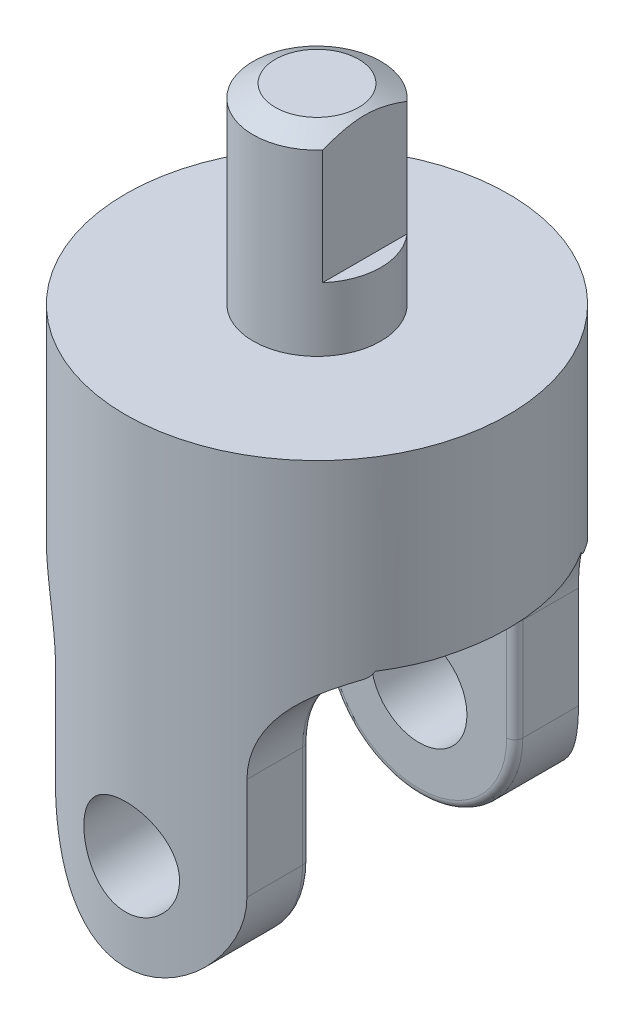
from build123d import *

# Parameters (mm, degrees)
SKETCH1_R               = 19.05
BASE_EXTRUDE_DEPTH      = 47.625
CUT_EXTRUDE1_DEPTH      = 55.716959208
CUT_EXTRUDE1_DEPTH_BACK = 55.716959208
CUT_EXTRUDE5_DEPTH      = 47.625
CUT_EXTRUDE5_DEPTH_BACK = 55.716959365
SKETCH8_W               = 20.32
SKETCH8_H               = 36.600526062
FILLET1_R               = 0.8001
CUT_EXTRUDE6_DEPTH      = 55.716959365
CUT_EXTRUDE6_DEPTH_BACK = 55.716959365
SKETCH11_R              = 4.7625
SKETCH12_R              = 6.35
BOSS_EXTRUDE1_DEPTH     = 19.05
CHAMFER3_SIZE           = 1.27
CHAMFER3_SIZE2          = 2.199704526
CUT_EXTRUDE7_START      = -12.7
CUT_EXTRUDE7_DEPTH      = 12.7


with BuildPart() as part:
    # Sketch1 → Base-Extrude (new body)
    with BuildSketch(Plane(origin=(0, 0, 0), x_dir=(-1, 0, 0), z_dir=(0, 1, 0))):
        with Locations(Location((0, 0, 0), (0, 0, 90))):
            Circle(SKETCH1_R)
    extrude(amount=BASE_EXTRUDE_DEPTH)

    # Sketch2 → Cut-Extrude1 (cut, two sides: drawn at the far end of the back side and taken through both)
    with BuildSketch(Plane.XY.offset(-CUT_EXTRUDE1_DEPTH_BACK)):
        with BuildLine():
            Line((9.525, 9.525), (9.525, 19.685))
            ThreePointArc((9.525, 19.685), (12.314807909, 26.420192091), (19.05, 29.21))
            Line((19.05, 29.21), (19.05, -1.366191125))
            Line((19.05, -1.366191125), (-19.05, -1.366191125))
            Line((-19.05, -1.366191125), (-19.05, 29.21))
            ThreePointArc((-19.05, 29.21), (-12.314807909, 26.420192091), (-9.525, 19.685))
            Line((-9.525, 19.685), (-9.525, 9.525))
            ThreePointArc((-9.525, 9.525), (0, 0), (9.525, 9.525))
        make_face()
    extrude(amount=CUT_EXTRUDE1_DEPTH + CUT_EXTRUDE1_DEPTH_BACK, mode=Mode.SUBTRACT)

    # Sketch8 → Cut-Extrude5 (cut, two sides: drawn at the far end of the back side and taken through both)
    with BuildSketch(Plane(origin=(0, 0, 0), x_dir=(0, 0, -1), z_dir=(1, 0, 0)).offset(-CUT_EXTRUDE5_DEPTH_BACK)):
        with Locations((0, 10.844975795)):
            Rectangle(SKETCH8_W, SKETCH8_H)
    extrude(amount=CUT_EXTRUDE5_DEPTH + CUT_EXTRUDE5_DEPTH_BACK, mode=Mode.SUBTRACT)

    # Fillet1
    # the kernel refuses this fillet: 0.8001 mm, written as the material it takes off along each edge
    with BuildSketch(Plane(origin=(0, 9.525, -10.16), x_dir=(1, 0, 0), z_dir=(0, 1, 0))) as fillet1_piece_1:
        with BuildLine():
            CenterArc((9.525 - FILLET1_R, FILLET1_R), FILLET1_R, 270, 90)
            Line((9.525, FILLET1_R), (9.525, 0))
            Line((9.525, 0), (9.525 - FILLET1_R, 0))
        make_face()
    revolve(axis=Axis((0, 9.525, -10.16), (0, 0, -1)), revolution_arc=180, mode=Mode.SUBTRACT)
    with BuildSketch(Plane(origin=(0, 9.525, 10.16), x_dir=(1, 0, 0), z_dir=(0, 1, 0))) as fillet1_piece_2:
        with BuildLine():
            CenterArc((9.525 - FILLET1_R, -FILLET1_R), FILLET1_R, 0, 90)
            Line((9.525 - FILLET1_R, 0), (9.525, 0))
            Line((9.525, 0), (9.525, -FILLET1_R))
        make_face()
    revolve(axis=Axis((0, 9.525, 10.16), (0, 0, -1)), revolution_arc=180, mode=Mode.SUBTRACT)
    with BuildSketch(Plane(origin=(9.525, 19.685, 10.16), x_dir=(0, 0, 1), z_dir=(0, -1, 0))) as fillet1_piece_3:
        with BuildLine():
            CenterArc((FILLET1_R, FILLET1_R), FILLET1_R, 180, 90)
            Line((0, FILLET1_R), (0, 0))
            Line((0, 0), (FILLET1_R, 0))
        make_face()
    extrude(amount=10.16, mode=Mode.SUBTRACT)
    with BuildSketch(Plane(origin=(19.05, 19.685, 10.16), x_dir=(-1, 0, 0), z_dir=(0, -1, 0))) as fillet1_piece_4_section:
        with BuildLine():
            CenterArc((9.525 + FILLET1_R, -FILLET1_R), FILLET1_R, 90, 90)
            Line((9.525 + FILLET1_R, 0), (9.525, 0))
            Line((9.525, 0), (9.525, -FILLET1_R))
        make_face()
    fillet1_piece_4 = revolve(axis=Axis((19.05, 19.685, 10.16), (0, 0, -1)), revolution_arc=84.085046105, mode=Mode.PRIVATE)
    fillet1_piece_4 = split(fillet1_piece_4, bisect_by=Plane(origin=(11.180350867, 29.145238826, 10.386376784), z_dir=(0, -1, 0)), keep=Keep.TOP, mode=Mode.PRIVATE)
    add(fillet1_piece_4, mode=Mode.SUBTRACT)
    with BuildSketch(Plane(origin=(19.05, 19.685, -10.16), x_dir=(-1, 0, 0), z_dir=(0, -1, 0))) as fillet1_piece_5_section:
        with BuildLine():
            CenterArc((9.525 + FILLET1_R, FILLET1_R), FILLET1_R, 180, 90)
            Line((9.525, FILLET1_R), (9.525, 0))
            Line((9.525, 0), (9.525 + FILLET1_R, 0))
        make_face()
    fillet1_piece_5 = revolve(axis=Axis((19.05, 19.685, -10.16), (0, 0, -1)), revolution_arc=84.085046117, mode=Mode.PRIVATE)
    fillet1_piece_5 = split(fillet1_piece_5, bisect_by=Plane(origin=(9.358714509, 29.145238826, -10.293177934), z_dir=(0, -1, 0)), keep=Keep.TOP, mode=Mode.PRIVATE)
    add(fillet1_piece_5, mode=Mode.SUBTRACT)
    with BuildSketch(Plane(origin=(9.525, 9.525, -10.16), x_dir=(-1, 0, 0), z_dir=(0, 1, 0)), Plane(origin=(-9.525, 9.525, 10.16), x_dir=(1, 0, 0), z_dir=(0, 1, 0)), Plane(origin=(-9.525, 19.685, -10.16), x_dir=(1, 0, 0), z_dir=(0, -1, 0))) as fillet1_piece_6:
        with BuildLine():
            CenterArc((FILLET1_R, -FILLET1_R), FILLET1_R, 90, 90)
            Line((0, -FILLET1_R), (0, 0))
            Line((0, 0), (FILLET1_R, 0))
        make_face()
    extrude(amount=10.16, mode=Mode.SUBTRACT)
    with BuildSketch(Plane(origin=(-19.05, 19.685, 10.16), x_dir=(0.1030521452465983, 0.9946759549522016, 0), z_dir=(-0.9946759549522016, 0.1030521452465983, 0))) as fillet1_piece_7_section:
        with BuildLine():
            CenterArc((9.525 + FILLET1_R, -FILLET1_R), FILLET1_R, 90, 90)
            Line((9.525, -FILLET1_R), (9.525, 0))
            Line((9.525, 0), (9.525 + FILLET1_R, 0))
        make_face()
    fillet1_piece_7 = revolve(axis=Axis((-19.05, 19.685, 10.16), (0, 0, -1)), revolution_arc=84.085046117, mode=Mode.PRIVATE)
    fillet1_piece_7 = split(fillet1_piece_7, bisect_by=Plane(origin=(-11.180351388, 29.145238826, 10.386376138), z_dir=(0, -1, 0)), keep=Keep.TOP, mode=Mode.PRIVATE)
    add(fillet1_piece_7, mode=Mode.SUBTRACT)
    with BuildSketch(Plane(origin=(-19.05, 19.685, -10.16), x_dir=(0.10305214545411669, 0.9946759549307018, 0), z_dir=(-0.9946759549307018, 0.10305214545411669, 0))) as fillet1_piece_8_section:
        with BuildLine():
            CenterArc((9.525 + FILLET1_R, FILLET1_R), FILLET1_R, 180, 90)
            Line((9.525, FILLET1_R), (9.525, 0))
            Line((9.525, 0), (9.525 + FILLET1_R, 0))
        make_face()
    fillet1_piece_8 = revolve(axis=Axis((-19.05, 19.685, -10.16), (0, 0, -1)), revolution_arc=84.085046105, mode=Mode.PRIVATE)
    fillet1_piece_8 = split(fillet1_piece_8, bisect_by=Plane(origin=(-11.180350867, 29.145238826, -10.386376784), z_dir=(0, -1, 0)), keep=Keep.TOP, mode=Mode.PRIVATE)
    add(fillet1_piece_8, mode=Mode.SUBTRACT)

    # Sketch11 → Cut-Extrude6 (cut, two sides: drawn at the far end of the back side and taken through both)
    with BuildSketch(Plane.XY.offset(-CUT_EXTRUDE6_DEPTH_BACK)):
        with Locations(Location((0, 9.525, 0), (0, 0, 270))):
            Circle(SKETCH11_R)
    extrude(amount=CUT_EXTRUDE6_DEPTH + CUT_EXTRUDE6_DEPTH_BACK, mode=Mode.SUBTRACT)

    # Sketch12 → Boss-Extrude1 (add)
    with BuildSketch(Plane(origin=(0, 47.625, 0), x_dir=(-1, 0, 0), z_dir=(0, 1, 0))):
        with Locations(Location((0, 0, 0), (0, 0, 270))):
            Circle(SKETCH12_R)
    extrude(amount=BOSS_EXTRUDE1_DEPTH)

    # Chamfer3
    chamfer3_edges = [part.edges().sort_by_distance(p)[0] for p in [
        (0, 66.675, 6.35),
    ]]
    chamfer3_side = [part.faces().sort_by_distance(p)[0] for p in [
        (0, 57.15, 6.35),
    ]]
    chamfer(chamfer3_edges, length=CHAMFER3_SIZE, length2=CHAMFER3_SIZE2, reference=chamfer3_side[0])

    # Sketch13 → Cut-Extrude7 (cut)
    with BuildSketch(Plane(origin=(0, 66.675, 0), x_dir=(-1, 0, 0), z_dir=(0, 1, 0)).offset(CUT_EXTRUDE7_START)):
        with BuildLine():
            Line((-4.7625, 4.200130206), (-4.7625, -4.200130206))
            ThreePointArc((-4.7625, -4.200130206), (-6.35, 0), (-4.7625, 4.200130206))
        make_face()
    extrude(amount=CUT_EXTRUDE7_DEPTH, mode=Mode.SUBTRACT)


solid = part.part
